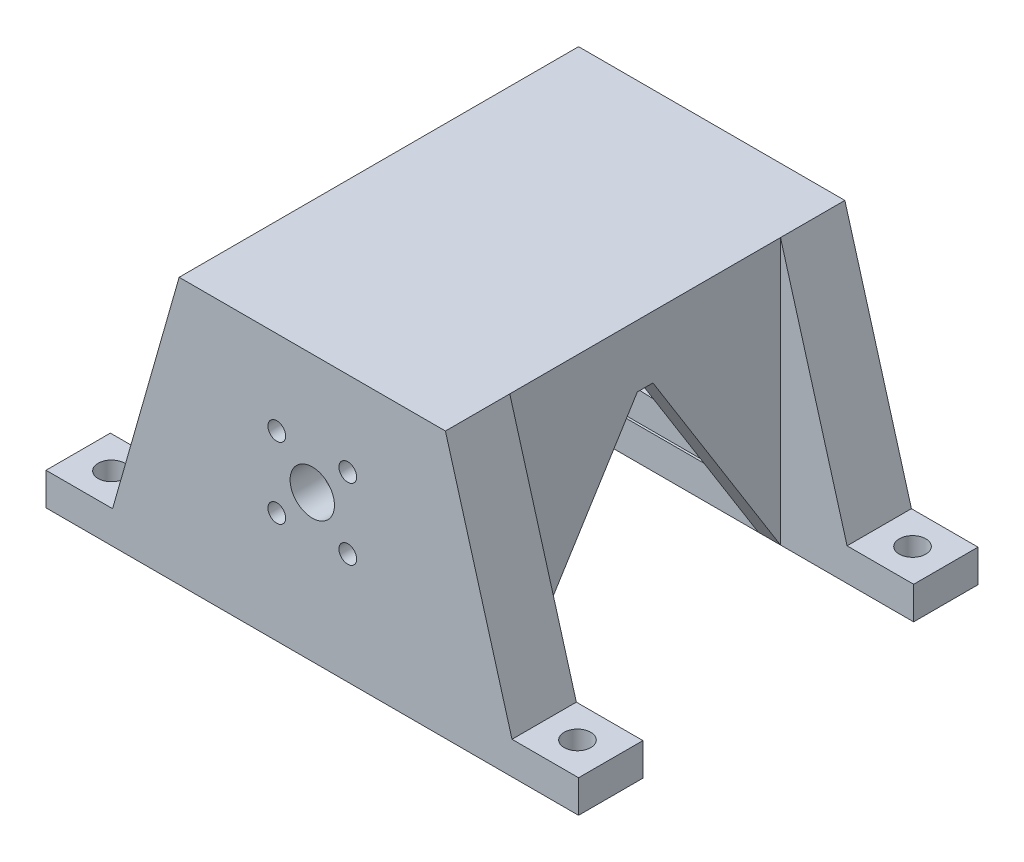
from build123d import *

# Parameters (mm, degrees)
SKETCH1_W                = 60
SKETCH1_H                = 60
BOSS_EXTRUDE1_DEPTH      = 90
CUT_EXTRUDE4_DEPTH       = 100.498743711
CUT_EXTRUDE4_DEPTH_BACK  = 100.498743711
SKETCH5_R                = 2
SKETCH5_R_2              = 5
CUT_EXTRUDE6_DEPTH       = 113.249721603
CUT_EXTRUDE6_DEPTH_BACK  = 113.249721603
SKETCH7_W                = 62
SKETCH7_H                = 50
SKETCH8_R                = 19.3
CUT_EXTRUDE7_DEPTH       = 83
SKETCH10_W               = 5
SKETCH10_H               = 30.5
BOSS_EXTRUDE2_DEPTH      = 46
CHAMFER1_SIZE            = 48.010035871
CHAMFER1_SIZE_2          = 30
SKETCH11_W               = 14.5
SKETCH11_H               = 60
BOSS_EXTRUDE3_DEPTH      = 15
SKETCH12_W               = 14.5
SKETCH12_H               = 60
BOSS_EXTRUDE4_DEPTH      = 15
CHAMFER2_SIZE            = 15
CHAMFER2_SIZE2           = 52.65790913
BOSS_EXTRUDE5_DEPTH      = 15
BOSS_EXTRUDE5_DEPTH_BACK = 105
SKETCH13_W               = 14.5
SKETCH13_H               = 7.34209087
F_6_0MM_DOWEL_HOLE1_D    = 6


with BuildPart() as part:
    # Sketch1 → Boss-Extrude1 (new body)
    with BuildSketch(Plane.XY):
        Rectangle(SKETCH1_W, SKETCH1_H)
    extrude(amount=BOSS_EXTRUDE1_DEPTH)

    # Sketch5 → Cut-Extrude4 (cut, two sides: drawn at the far end of the back side and taken through both)
    with BuildSketch(Plane(origin=(0, 0, 0), x_dir=(-1, 0, 0), z_dir=(0, 0, -1)).offset(-CUT_EXTRUDE4_DEPTH_BACK)):
        with Locations((-8, 11)):
            Circle(SKETCH5_R)
        with Locations((8, 11)):
            Circle(SKETCH5_R)
        with Locations((8, -5)):
            Circle(SKETCH5_R)
        with Locations((-8, -5)):
            Circle(SKETCH5_R)
        with Locations((0, 3)):
            Circle(SKETCH5_R_2)
    extrude(amount=CUT_EXTRUDE4_DEPTH + CUT_EXTRUDE4_DEPTH_BACK, mode=Mode.SUBTRACT)

    # Sketch7 → Cut-Extrude6 (cut, two sides: drawn at the far end of the back side and taken through both)
    with BuildSketch(Plane.ZY.offset(30).offset(-CUT_EXTRUDE6_DEPTH_BACK)):
        with Locations((45, -9)):
            Rectangle(SKETCH7_W, SKETCH7_H)
    extrude(amount=CUT_EXTRUDE6_DEPTH + CUT_EXTRUDE6_DEPTH_BACK, mode=Mode.SUBTRACT)

    # Sketch8 → Cut-Extrude7 (cut)
    with BuildSketch(Plane(origin=(0, 0, 0), x_dir=(-1, 0, 0), z_dir=(0, 0, -1))):
        with Locations((0, 3)):
            Circle(SKETCH8_R)
    extrude(amount=-CUT_EXTRUDE7_DEPTH, mode=Mode.SUBTRACT)

    # Sketch10 → Boss-Extrude2 (add)
    with BuildSketch(Plane.XZ.offset(-16)):
        with Locations((-27.5, 60.75)):
            Rectangle(SKETCH10_W, SKETCH10_H)
        with Locations((-27.5, 29.25)):
            Rectangle(SKETCH10_W, SKETCH10_H)
        with Locations((27.5, 60.75)):
            Rectangle(SKETCH10_W, SKETCH10_H)
        with Locations((27.5, 29.25)):
            Rectangle(SKETCH10_W, SKETCH10_H)
    extrude(amount=BOSS_EXTRUDE2_DEPTH)

    # Chamfer1
    # the kernel refuses this chamfer: 48.010035871, 30 mm, written as the material it takes off along each edge
    with BuildSketch(Plane(origin=(99.122648056, -30, 44.5), x_dir=(0, 0.9997899140358645, 0.02049701910421798), z_dir=(-1, 0, 0))) as chamfer1_piece_1_section:
        Polygon((CHAMFER1_SIZE * 0.999789914041, CHAMFER1_SIZE * 0.0204970191043), (-CHAMFER1_SIZE_2 * 0.0204970191042, CHAMFER1_SIZE_2 * 0.999789914036), (0, 0), align=None)
    chamfer1_piece_1 = extrude(amount=253.245296112, mode=Mode.PRIVATE)
    chamfer1_piece_1 = split(chamfer1_piece_1, bisect_by=Plane(origin=(-27.5, 16, 34.735639976), z_dir=(0, -1, 0)), keep=Keep.TOP, mode=Mode.PRIVATE)
    add(chamfer1_piece_1, mode=Mode.SUBTRACT)
    with BuildSketch(Plane(origin=(-99.122648056, -30, 44.5), x_dir=(0, 0.9997899140358645, 0.02049701910421798), z_dir=(1, 0, 0))) as chamfer1_piece_2_section:
        Polygon((CHAMFER1_SIZE * 0.999789914041, -CHAMFER1_SIZE * 0.0204970191043), (-CHAMFER1_SIZE_2 * 0.0204970191042, -CHAMFER1_SIZE_2 * 0.999789914036), (0, 0), align=None)
    chamfer1_piece_2 = extrude(amount=253.245296112, mode=Mode.PRIVATE)
    chamfer1_piece_2 = split(chamfer1_piece_2, bisect_by=Plane(origin=(27.5, 16, 34.735639976), z_dir=(0, -1, 0)), keep=Keep.TOP, mode=Mode.PRIVATE)
    add(chamfer1_piece_2, mode=Mode.SUBTRACT)
    with BuildSketch(Plane(origin=(-99.122648056, -30, 45.5), x_dir=(0, 0.9997899140358645, -0.020497019104217966), z_dir=(1, 0, 0))) as chamfer1_piece_3_section:
        Polygon((CHAMFER1_SIZE * 0.999789914041, CHAMFER1_SIZE * 0.0204970191043), (-CHAMFER1_SIZE_2 * 0.0204970191042, CHAMFER1_SIZE_2 * 0.999789914036), (0, 0), align=None)
    chamfer1_piece_3 = extrude(amount=253.245296112, mode=Mode.PRIVATE)
    chamfer1_piece_3 = split(chamfer1_piece_3, bisect_by=Plane(origin=(27.5, 16, 55.264360024), z_dir=(0, -1, 0)), keep=Keep.TOP, mode=Mode.PRIVATE)
    add(chamfer1_piece_3, mode=Mode.SUBTRACT)
    with BuildSketch(Plane(origin=(99.122648056, -30, 45.5), x_dir=(0, -0.05243311939005598, 0.9986244379099823), z_dir=(-1, 0, 0))) as chamfer1_piece_4_section:
        Polygon((CHAMFER1_SIZE_2 * 0.99862443791, CHAMFER1_SIZE_2 * 0.0524331193901), (-CHAMFER1_SIZE * 0.0524331193903, CHAMFER1_SIZE * 0.998624437915), (0, 0), align=None)
    chamfer1_piece_4 = extrude(amount=253.245296112, mode=Mode.PRIVATE)
    chamfer1_piece_4 = split(chamfer1_piece_4, bisect_by=Plane(origin=(-27.5, 16, 55.264360024), z_dir=(0, -1, 0)), keep=Keep.TOP, mode=Mode.PRIVATE)
    add(chamfer1_piece_4, mode=Mode.SUBTRACT)

    # Sketch11 → Boss-Extrude3 (add)
    with BuildSketch(Plane.ZY.offset(30)):
        with Locations((7.25, 0)):
            Rectangle(SKETCH11_W, SKETCH11_H)
        with Locations((82.75, 0)):
            Rectangle(SKETCH11_W, SKETCH11_H)
    extrude(amount=BOSS_EXTRUDE3_DEPTH)

    # Sketch12 → Boss-Extrude4 (add)
    with BuildSketch(Plane(origin=(30, 0, 0), x_dir=(0, 0, -1), z_dir=(1, 0, 0))):
        with Locations((-82.75, 0)):
            Rectangle(SKETCH12_W, SKETCH12_H)
        with Locations((-7.25, 0)):
            Rectangle(SKETCH12_W, SKETCH12_H)
    extrude(amount=BOSS_EXTRUDE4_DEPTH)

    # Chamfer2
    chamfer2_edges = [part.edges().sort_by_distance(p)[0] for p in [
        (-45, 30, 7.25),
        (-45, 30, 82.75),
        (45, 30, 82.75),
        (45, 30, 7.25),
    ]]
    chamfer2_side = [part.faces().sort_by_distance(p)[0] for p in [
        (0, 30, 45),
    ]]
    chamfer(chamfer2_edges, length=CHAMFER2_SIZE, length2=CHAMFER2_SIZE2, reference=chamfer2_side[0])

    # Sketch13 → Boss-Extrude5 (add, two sides: drawn at the far end of the back side and taken through both)
    with BuildSketch(Plane(origin=(45, 0, 0), x_dir=(0, 0, -1), z_dir=(1, 0, 0)).offset(-BOSS_EXTRUDE5_DEPTH_BACK)):
        with Locations((-82.75, -26.328954565)):
            Rectangle(SKETCH13_W, SKETCH13_H)
        with Locations((-7.25, -26.328954565)):
            Rectangle(SKETCH13_W, SKETCH13_H)
    extrude(amount=BOSS_EXTRUDE5_DEPTH + BOSS_EXTRUDE5_DEPTH_BACK)

    # Ø6.0mm Dowel Hole1 (through all)
    with Locations(Plane(origin=(52.5, -22.65790913, 82.75), x_dir=(1, 0, 0), z_dir=(0, 1, 0))):
        with Locations((0, 0), (0, 75.5), (-105, 75.5), (-105, 0)):
            Hole(F_6_0MM_DOWEL_HOLE1_D / 2)


solid = part.part
